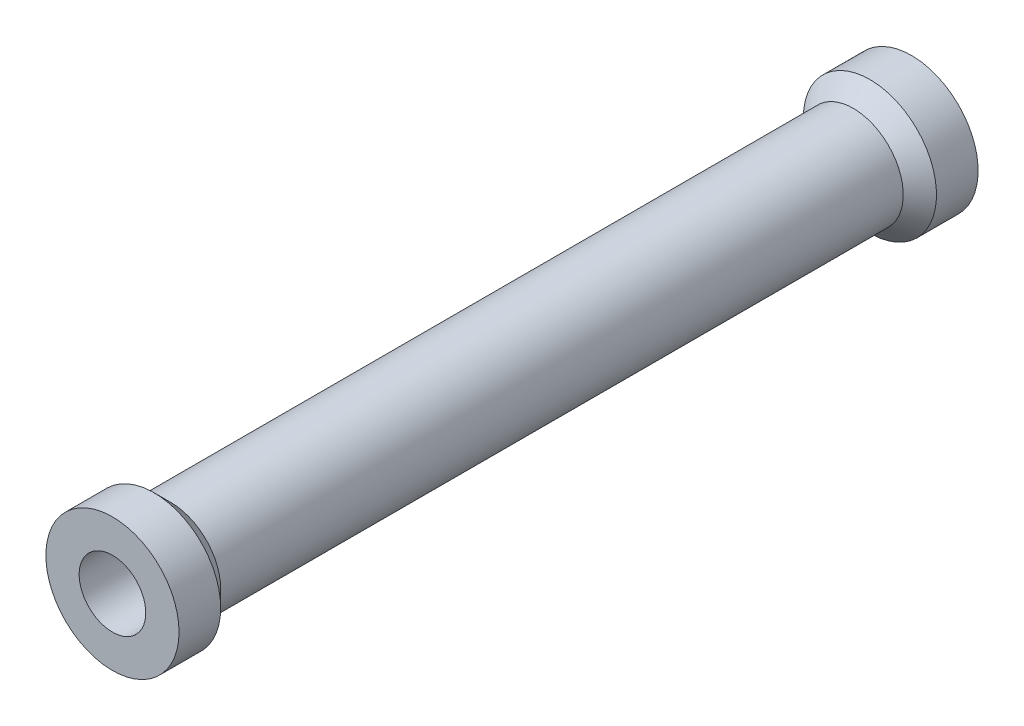
from build123d import *

# Parameters (mm, degrees)
SKETCH1_R           = 4.7625
BOSS_EXTRUDE1_DEPTH = 31.75
SKETCH2_R           = 6.35
BOSS_EXTRUDE2_DEPTH = 6.35
CHAMFER1_SIZE       = 2.38
SKETCH3_R           = 3.175
CUT_EXTRUDE1_DEPTH  = 12.7
BOSS_EXTRUDE3_START = 31.75
SKETCH4_R           = 4.7625
BOSS_EXTRUDE3_DEPTH = 31.75
BOSS_EXTRUDE4_START = 6.35
SKETCH5_R           = 6.35
BOSS_EXTRUDE4_DEPTH = 6.35
CHAMFER2_SIZE       = 2.38
CUT_EXTRUDE2_START  = -12.7
SKETCH6_R           = 3.175
CUT_EXTRUDE2_DEPTH  = 12.7


with BuildPart() as part:
    # Sketch1 → Boss-Extrude1 (new body)
    with BuildSketch(Plane.XY):
        Circle(SKETCH1_R)
    extrude(amount=BOSS_EXTRUDE1_DEPTH)

    # Sketch2 → Boss-Extrude2 (add)
    with BuildSketch(Plane.XY.offset(31.75)):
        Circle(SKETCH2_R)
    extrude(amount=BOSS_EXTRUDE2_DEPTH)

    # Chamfer1
    # the kernel refuses this chamfer: 2.38 mm, written as the material it takes off along each edge
    with BuildSketch(Plane(origin=(0, 0, 31.75), x_dir=(1, 0, 0), z_dir=(0, -1, 0))) as chamfer1_piece_1_section:
        Polygon((6.35, CHAMFER1_SIZE), (6.35 - CHAMFER1_SIZE, 0), (6.35, 0), align=None)
    chamfer1_piece_1 = revolve(axis=Axis((0, 0, 31.75), (0, 0, 1)), mode=Mode.PRIVATE)
    chamfer1_piece_1 = chamfer1_piece_1 - Plane(origin=(0, 0, 33.337286279), x_dir=(1, 0, 0), z_dir=(0, 0, -1)) * Cylinder(4.7625, 26, mode=Mode.PRIVATE)
    add(chamfer1_piece_1, mode=Mode.SUBTRACT)

    # Sketch3 → Cut-Extrude1 (cut)
    with BuildSketch(Plane.XY.offset(38.1)):
        Circle(SKETCH3_R)
    extrude(amount=-CUT_EXTRUDE1_DEPTH, mode=Mode.SUBTRACT)

    # Sketch4 → Boss-Extrude3 (add)
    with BuildSketch(Plane(origin=(0, 0, 0), x_dir=(-1, 0, 0), z_dir=(0, 0, -1)).offset(BOSS_EXTRUDE3_START)):
        Circle(SKETCH4_R)
    extrude(amount=-BOSS_EXTRUDE3_DEPTH)

    # Sketch5 → Boss-Extrude4 (add)
    with BuildSketch(Plane(origin=(0, 0, -31.75), x_dir=(-1, 0, 0), z_dir=(0, 0, -1)).offset(BOSS_EXTRUDE4_START)):
        with Locations(Location((0, 0, 0), (0, 0, 180))):
            Circle(SKETCH5_R)
    extrude(amount=-BOSS_EXTRUDE4_DEPTH)

    # Chamfer2
    # the kernel refuses this chamfer: 2.38 mm, written as the material it takes off along each edge
    with BuildSketch(Plane(origin=(0, 0, -31.75), x_dir=(1, 0, 0), z_dir=(0, 1, 0))) as chamfer2_piece_1_section:
        Polygon((6.35, CHAMFER2_SIZE), (6.35 - CHAMFER2_SIZE, 0), (6.35, 0), align=None)
    chamfer2_piece_1 = revolve(axis=Axis((0, 0, -31.75), (0, 0, -1)), mode=Mode.PRIVATE)
    chamfer2_piece_1 = chamfer2_piece_1 - Plane(origin=(0, 0, -33.337286279), x_dir=(-1, 0, 0), z_dir=(0, 0, -1)) * Cylinder(4.7625, 26, mode=Mode.PRIVATE)
    add(chamfer2_piece_1, mode=Mode.SUBTRACT)

    # Sketch6 → Cut-Extrude2 (cut)
    with BuildSketch(Plane(origin=(0, 0, -38.1), x_dir=(-1, 0, 0), z_dir=(0, 0, -1)).offset(CUT_EXTRUDE2_START)):
        with Locations(Location((0, 0, 0), (0, 0, 180))):
            Circle(SKETCH6_R)
    extrude(amount=CUT_EXTRUDE2_DEPTH, mode=Mode.SUBTRACT)


solid = part.part
